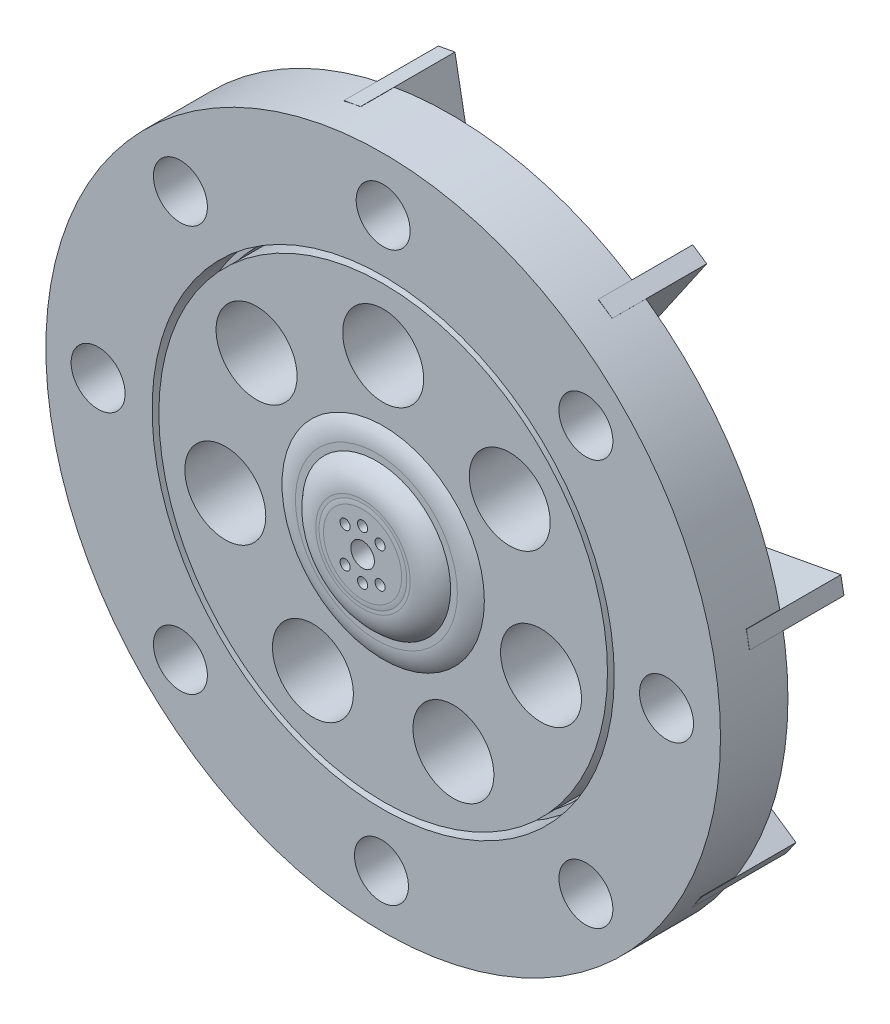
from build123d import *

# Parameters (mm, degrees)
BOSS_EXTRUDE1_DEPTH       = 10
BOSS_EXTRUDE1_DEPTH_BACK  = 10
SKETCH1_R                 = 100
SKETCH1_R_2               = 8
SKETCH4_R                 = 30
BOSS_EXTRUDE2_DEPTH       = 12
SKETCH5_R                 = 22
BOSS_EXTRUDE3_DEPTH       = 4
SKETCH6_R                 = 13
BOSS_EXTRUDE4_DEPTH       = 0.1
SKETCH2_R                 = 68.5
SKETCH2_R_2               = 66.5
CUT_EXTRUDE11_DEPTH       = 66
SKETCH7_R                 = 12
CUT_EXTRUDE12_DEPTH       = 31
SKETCH9_R                 = 8
CUT_EXTRUDE13_DEPTH       = 31
SKETCH10_R                = 1.5
SKETCH10_R_2              = 3.5
CUT_EXTRUDE14_DEPTH       = 31
FILLET5_R                 = 10
EXTRUDE_THIN2_START       = -28
EXTRUDE_THIN2_DEPTH       = 28
EXTRUDE_THIN2_2_OUTLINE_R = 23.5
EXTRUDE_THIN2_2_DEPTH     = 28
EXTRUDE_THIN2_3_DEPTH     = 28
EXTRUDE_THIN2_4_DEPTH     = 28
EXTRUDE_THIN2_5_DEPTH     = 28
EXTRUDE_THIN2_6_DEPTH     = 28
EXTRUDE_THIN2_7_DEPTH     = 28
EXTRUDE_THIN2_8_DEPTH     = 28
EXTRUDE_THIN2_9_DEPTH     = 28


with BuildPart() as part:
    # Sketch1 → Boss-Extrude1 (new, two sides: drawn at the far end of the back side and taken through both)
    with BuildSketch(Plane.XY.offset(-BOSS_EXTRUDE1_DEPTH_BACK)):
        Circle(SKETCH1_R)
        with Locations((0, 84)):
            Circle(SKETCH1_R_2, mode=Mode.SUBTRACT)
        with Locations((84, -0.507247964)):
            Circle(SKETCH1_R_2, mode=Mode.SUBTRACT)
        with Locations((-0.507247964, -84.507247964)):
            Circle(SKETCH1_R_2, mode=Mode.SUBTRACT)
        with Locations((-84.507247964, 0)):
            Circle(SKETCH1_R_2, mode=Mode.SUBTRACT)
    extrude(amount=BOSS_EXTRUDE1_DEPTH + BOSS_EXTRUDE1_DEPTH_BACK)

    # Sketch4 → Boss-Extrude2 (add)
    with BuildSketch(Plane.XY):
        Circle(SKETCH4_R)
    extrude(amount=BOSS_EXTRUDE2_DEPTH)

    # Sketch5 → Boss-Extrude3 (add)
    with BuildSketch(Plane.XY.offset(12)):
        Circle(SKETCH5_R)
    extrude(amount=BOSS_EXTRUDE3_DEPTH)

    # Sketch6 → Boss-Extrude4 (add)
    with BuildSketch(Plane.XY.offset(16)):
        Circle(SKETCH6_R)
    extrude(amount=BOSS_EXTRUDE4_DEPTH)

    # Sketch2 → Cut-Extrude11 (cut, symmetric)
    with BuildSketch(Plane.XY):
        Circle(SKETCH2_R)
        Circle(SKETCH2_R_2, mode=Mode.SUBTRACT)
    extrude(amount=CUT_EXTRUDE11_DEPTH, both=True, mode=Mode.SUBTRACT)


with BuildPart() as cut_extrude11_piece_1:
    # of the separate pieces the step leaves, piece 1, a body of its own (cut_extrude11_pieces)
    add(part.part.solids().sort_by_distance((100, 0, 0))[0])

    # Sketch9 → Cut-Extrude13 (cut, symmetric)
    with BuildSketch(Plane.XY.offset(10)):
        with Locations((-60.104076401, 60.104076401)):
            Circle(SKETCH9_R)
        with Locations((60.104076401, 60.104076401)):
            Circle(SKETCH9_R)
        with Locations((60.104076401, -60.104076401)):
            Circle(SKETCH9_R)
        with Locations((-60.104076401, -60.104076401)):
            Circle(SKETCH9_R)
    extrude(amount=CUT_EXTRUDE13_DEPTH, both=True, mode=Mode.SUBTRACT)


with BuildPart() as cut_extrude11_piece_2:
    # of the separate pieces the step leaves, piece 2, a body of its own (cut_extrude11_pieces)
    add(part.part.solids().sort_by_distance((66.5, 0, 10))[0])

    # Sketch7 → Cut-Extrude12 (cut, symmetric)
    with BuildSketch(Plane.XY.offset(10)):
        with Locations((0, 48)):
            Circle(SKETCH7_R)
        with Locations((37.527911158, 29.927510489)):
            Circle(SKETCH7_R)
        with Locations((46.796539785, -10.68100483)):
            Circle(SKETCH7_R)
        with Locations((20.826419478, -43.246505659)):
            Circle(SKETCH7_R)
        with Locations((-20.826419478, -43.246505659)):
            Circle(SKETCH7_R)
        with Locations((-46.796539785, -10.68100483)):
            Circle(SKETCH7_R)
        with Locations((-37.527911158, 29.927510489)):
            Circle(SKETCH7_R)
    extrude(amount=CUT_EXTRUDE12_DEPTH, both=True, mode=Mode.SUBTRACT)

    # Sketch10 → Cut-Extrude14 (cut, symmetric)
    with BuildSketch(Plane.XY.offset(16.1)):
        with Locations((0, 7.296037155)):
            Circle(SKETCH10_R)
        with Locations((0, -7.296037155)):
            Circle(SKETCH10_R)
        with Locations((-5.18978461, 5.177728197)):
            Circle(SKETCH10_R)
        with Locations((5.177728197, 5.18978461)):
            Circle(SKETCH10_R)
        with Locations((5.18978461, -5.177728197)):
            Circle(SKETCH10_R)
        with Locations((-5.177728197, -5.18978461)):
            Circle(SKETCH10_R)
        Circle(SKETCH10_R_2)
    extrude(amount=CUT_EXTRUDE14_DEPTH, both=True, mode=Mode.SUBTRACT)

    # Fillet5
    # the kernel refuses this fillet: 10 mm, written as the material it takes off along each edge
    with BuildSketch(Plane(origin=(0, 0, 12), x_dir=(1, 0, 0), z_dir=(0, -1, 0))) as fillet5_piece_1:
        with BuildLine():
            CenterArc((24, -10), FILLET5_R, 53.130102354, 36.869897646)
            Line((24, 0), (30, 0))
            Line((30, 0), (30, -2))
        make_face()
    revolve(axis=Axis((0, 0, 12), (0, 0, 1)), mode=Mode.SUBTRACT)
    with BuildSketch(Plane(origin=(0, 0, 16), x_dir=(1, 0, 0), z_dir=(0, -1, 0))) as fillet5_piece_2:
        with BuildLine():
            CenterArc((14, -10), FILLET5_R, 36.869897646, 53.130102354)
            Line((14, 0), (22, 0))
            Line((22, 0), (22, -4))
        make_face()
    revolve(axis=Axis((0, 0, 16), (0, 0, 1)), mode=Mode.SUBTRACT)
    with BuildSketch(Plane(origin=(0, 0, 16.1), x_dir=(1, 0, 0), z_dir=(0, -1, 0))) as fillet5_piece_3:
        with BuildLine():
            CenterArc((11.589326402, -10), FILLET5_R, 81.890385544, 8.109614456)
            Line((13, -0.1), (13, 0))
            Line((13, 0), (11.589326402, 0))
        make_face()
    revolve(axis=Axis((0, 0, 16.1), (0, 0, 1)), mode=Mode.SUBTRACT)


with BuildPart() as body_3:
    # Extrude-Thin2: read off the stored shape, not the designer's step
    # Extrude-Thin2 outline → Extrude-Thin2 (new body)
    with BuildSketch(Plane.XY.offset(EXTRUDE_THIN2_START)):
        Polygon((98.605334288, 16.710417409), (97.696064002, 21.627045069), (68.660059433, 16.257190367), (69.205621604, 13.307213771), (69.233522979, 13.31237379), (69.597231093, 11.345722725), align=None)
    extrude(amount=EXTRUDE_THIN2_DEPTH)


with BuildPart() as body_4:
    # Extrude-Thin2 2 outline → Extrude-Thin2 2 (new body)
    with BuildSketch(Plane.XY.offset(EXTRUDE_THIN2_START)):
        with BuildLine():
            Line((-16.710417409, 98.605334288), (-21.627045069, 97.696064002))
            Line((-21.627045069, 97.696064002), (-16.177141795, 68.227218914))
            Line((-16.177141795, 68.227218914), (-14.210490731, 68.590927029))
            Line((-14.210490731, 68.590927029), (-14.201849303, 68.544200895))
            ThreePointArc((-14.201849303, 68.544200895), (12.729784031, -68.832787235), (-11.251872707, 69.089763067))
            Line((-11.251872707, 69.089763067), (-16.710417409, 98.605334288))
        make_face()
        with BuildLine():
            Line((-52.592445033, -41.509453447), (-20.227186943, -17.12048213))
            ThreePointArc((-20.227186943, -17.12048213), (-0.924836663, -26.483856916), (18.98365007, -18.489754731))
            Line((18.98365007, -18.489754731), (49.568779381, -45.077002015))
            ThreePointArc((49.568779381, -45.077002015), (-2.338266279, -66.95918541), (-52.592445033, -41.509453447))
        make_face(mode=Mode.SUBTRACT)
        Circle(EXTRUDE_THIN2_2_OUTLINE_R, mode=Mode.SUBTRACT)
        with BuildLine():
            Line((51.536956468, -42.812873275), (20.951827157, -16.225625991))
            ThreePointArc((20.951827157, -16.225625991), (0.924836663, 26.483856916), (-22.032632012, -14.7245756))
            Line((-22.032632012, -14.7245756), (-54.397890103, -39.113546917))
            ThreePointArc((-54.397890103, -39.113546917), (2.338266279, 66.95918541), (51.536956468, -42.812873275))
        make_face(mode=Mode.SUBTRACT)
    extrude(amount=EXTRUDE_THIN2_2_DEPTH)


with BuildPart() as body_5:
    # Extrude-Thin2 3 outline → Extrude-Thin2 3 (new body)
    with BuildSketch(Plane.XY.offset(EXTRUDE_THIN2_START)):
        Polygon((-98.605334288, -16.710417409), (-97.696064002, -21.627045069), (-68.660059433, -16.257190367), (-69.205621604, -13.307213771), (-69.233522979, -13.31237379), (-69.597231093, -11.345722725), align=None)
    extrude(amount=EXTRUDE_THIN2_3_DEPTH)


with BuildPart() as body_6:
    # Extrude-Thin2 4 outline → Extrude-Thin2 4 (new body)
    with BuildSketch(Plane.XY.offset(EXTRUDE_THIN2_START)):
        Polygon((16.710417409, -98.605334288), (21.627045069, -97.696064002), (16.257190367, -68.660059433), (13.307213771, -69.205621604), (13.31237379, -69.233522979), (11.345722725, -69.597231093), align=None)
    extrude(amount=EXTRUDE_THIN2_4_DEPTH)


with BuildPart() as body_7:
    # Extrude-Thin2 5 outline → Extrude-Thin2 5 (new body)
    with BuildSketch(Plane.XY.offset(EXTRUDE_THIN2_START)):
        Polygon((-1.359461681, -0.633927393), (0, 0), (1.311929561, -0.72721443), (1.911187207, 0.353874982), (1.343253608, 0.668685717), (0.837076781, 1.754185426), (0.048415078, 1.386426434), (-0.712671914, 1.808303843), (-1.293336352, 0.760757467), (-1.881846581, 0.486330641), align=None)
    extrude(amount=EXTRUDE_THIN2_5_DEPTH)


with BuildPart() as body_8:
    # Extrude-Thin2 6 outline → Extrude-Thin2 6 (new body)
    with BuildSketch(Plane.XY.offset(EXTRUDE_THIN2_START)):
        Polygon((81.540550002, -57.90845107), (84.374179577, -53.788919126), (60.045563173, -37.05442407), (58.345385429, -39.526143237), (58.368763364, -39.542223804), (57.235311534, -41.190036581), align=None)
    extrude(amount=EXTRUDE_THIN2_6_DEPTH)


with BuildPart() as body_9:
    # Extrude-Thin2 7 outline → Extrude-Thin2 7 (new body)
    with BuildSketch(Plane.XY.offset(EXTRUDE_THIN2_START)):
        Polygon((-57.90845107, -81.540550002), (-53.788919126, -84.374179577), (-37.05442407, -60.045563173), (-39.526143237, -58.345385429), (-39.542223804, -58.368763364), (-41.190036581, -57.235311534), align=None)
    extrude(amount=EXTRUDE_THIN2_7_DEPTH)


with BuildPart() as body_10:
    # Extrude-Thin2 8 outline → Extrude-Thin2 8 (new body)
    with BuildSketch(Plane.XY.offset(EXTRUDE_THIN2_START)):
        Polygon((-81.540550002, 57.90845107), (-84.374179577, 53.788919126), (-60.045563173, 37.05442407), (-58.345385429, 39.526143237), (-58.368763364, 39.542223804), (-57.235311534, 41.190036581), align=None)
    extrude(amount=EXTRUDE_THIN2_8_DEPTH)


with BuildPart() as body_11:
    # Extrude-Thin2 9 outline → Extrude-Thin2 9 (new body)
    with BuildSketch(Plane.XY.offset(EXTRUDE_THIN2_START)):
        Polygon((57.90845107, 81.540550002), (53.788919126, 84.374179577), (37.05442407, 60.045563173), (39.526143237, 58.345385429), (39.542223804, 58.368763364), (41.190036581, 57.235311534), align=None)
    extrude(amount=EXTRUDE_THIN2_9_DEPTH)


solid = Compound([cut_extrude11_piece_1.part, cut_extrude11_piece_2.part, body_3.part, body_4.part, body_5.part, body_6.part, body_7.part, body_8.part, body_9.part, body_10.part, body_11.part])
